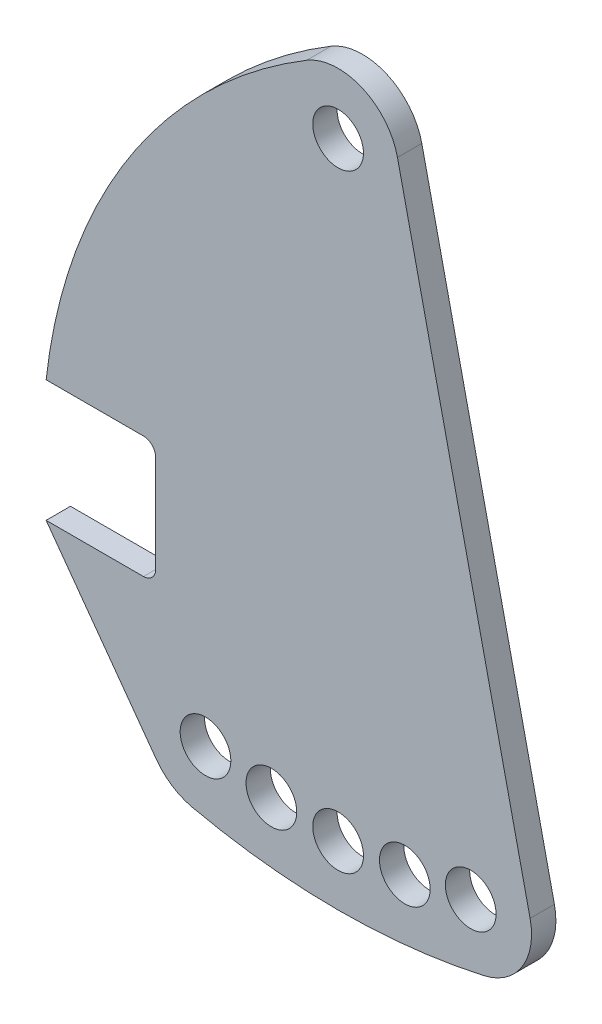
from build123d import *

# Parameters (mm, degrees)
SKETCH_1_R             = 6.25
SM_BASE_FLANGE_1_DEPTH = 6


# Sheet-metal steps are written as plain solids
with BuildPart() as part:
    # Sketch 1 → Базовая кромка1 (new body)
    with BuildSketch(Plane.XY):
        with BuildLine():
            Line((-12, -15), (12, -15))
            ThreePointArc((12, -15), (14.121320344, -14.121320344), (15, -12))
            Line((15, -12), (15, 12))
            ThreePointArc((15, 12), (14.121320344, 14.121320344), (12, 15))
            Line((12, 15), (-12, 15))
            ThreePointArc((-12, 15), (8.423008458, 72.651269477), (52.225050565, 115.337909706))
            ThreePointArc((52.225050565, 115.337909706), (65.873295621, 116.29514987), (74.621175956, 105.775383166))
            Line((74.621175956, 105.775383166), (107.314124719, -40.33280529))
            ThreePointArc((107.314124719, -40.33280529), (105.342791215, -51.642791703), (95.951479838, -58.246216503))
            ThreePointArc((95.951479838, -58.246216503), (59.983147908, -62.22117964), (24.014815979, -58.246216503))
            ThreePointArc((24.014815979, -58.246216503), (19.049536185, -56.141802219), (15.149410164, -52.417345221))
            Line((15.149410164, -52.417345221), (-12, -15))
        make_face()
        with Locations((59.983147908, 102.5)):
            Circle(SKETCH_1_R, mode=Mode.SUBTRACT)
        with Locations((27.290199146, -43.608188456)):
            Circle(SKETCH_1_R, mode=Mode.SUBTRACT)
        with Locations((43.533377705, -46.421825098)):
            Circle(SKETCH_1_R, mode=Mode.SUBTRACT)
        with Locations((59.983147908, -47.5)):
            Circle(SKETCH_1_R, mode=Mode.SUBTRACT)
        with Locations((76.432918112, -46.421825098)):
            Circle(SKETCH_1_R, mode=Mode.SUBTRACT)
        with Locations((92.676096671, -43.608188456)):
            Circle(SKETCH_1_R, mode=Mode.SUBTRACT)
    extrude(amount=SM_BASE_FLANGE_1_DEPTH)


solid = part.part
